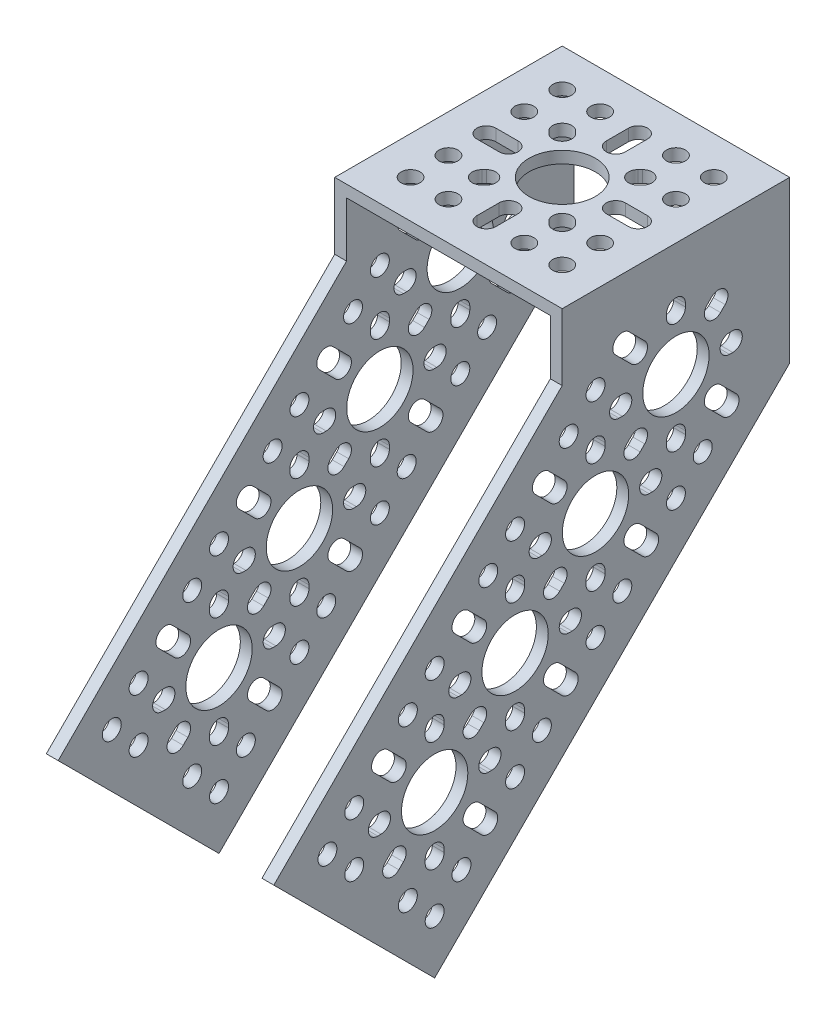
from build123d import *

# Parameters (mm, degrees)
BOSS_EXTRUDE1_DEPTH = 2.5
SKETCH2_W           = 2.5
SKETCH2_H           = 48
BOSS_EXTRUDE2_DEPTH = 11.558874503
SKETCH3_W           = 2.5
SKETCH3_H           = 48
BOSS_EXTRUDE3_DEPTH = 86.058874503
SKETCH4_W           = 45.5
SKETCH4_H           = 48
BOSS_EXTRUDE4_DEPTH = 2.5
BOSS_EXTRUDE5_DEPTH = 2.5
CUT_EXTRUDE1_DEPTH  = 144.461391987
CUT_EXTRUDE2_DEPTH  = 144.461391987
CUT_EXTRUDE3_DEPTH  = 144.461391987
CUT_EXTRUDE4_DEPTH  = 144.461391987
CUT_EXTRUDE5_DEPTH  = 144.461391987
CUT_EXTRUDE6_DEPTH  = 144.461391987
CUT_EXTRUDE7_DEPTH  = 144.461391987
CUT_EXTRUDE8_DEPTH  = 144.461391987
CUT_EXTRUDE9_DEPTH  = 144.461391987
CUT_EXTRUDE10_DEPTH = 144.461391987
CUT_EXTRUDE11_DEPTH = 144.461391987
CUT_EXTRUDE12_DEPTH = 144.461391987
CUT_EXTRUDE13_DEPTH = 144.461391987
CUT_EXTRUDE14_DEPTH = 144.461391987
CUT_EXTRUDE15_DEPTH = 144.461391987
CUT_EXTRUDE16_DEPTH = 144.461391987
CUT_EXTRUDE17_DEPTH = 144.461391987
CUT_EXTRUDE18_DEPTH = 144.461391987
CUT_EXTRUDE19_DEPTH = 144.461391987
CUT_EXTRUDE20_DEPTH = 144.461391987
CUT_EXTRUDE21_DEPTH = 144.461391987
CUT_EXTRUDE22_DEPTH = 144.461391987
CUT_EXTRUDE23_DEPTH = 144.461391987
CUT_EXTRUDE24_DEPTH = 144.461391987
CUT_EXTRUDE25_DEPTH = 144.461391987
CUT_EXTRUDE26_DEPTH = 144.461391987
CUT_EXTRUDE27_DEPTH = 144.461391987
CUT_EXTRUDE28_DEPTH = 144.461391987
CUT_EXTRUDE29_DEPTH = 141.089025479
CUT_EXTRUDE30_DEPTH = 141.089025479
CUT_EXTRUDE31_DEPTH = 141.089025479
CUT_EXTRUDE32_DEPTH = 141.089025479
CUT_EXTRUDE33_DEPTH = 141.089025479
CUT_EXTRUDE34_DEPTH = 141.089025479
CUT_EXTRUDE35_DEPTH = 141.089025479
CUT_EXTRUDE36_REACH = 146.274
CUT_EXTRUDE37_REACH = 146.274
CUT_EXTRUDE38_REACH = 146.274
CUT_EXTRUDE39_REACH = 146.274
CUT_EXTRUDE40_REACH = 146.274
CUT_EXTRUDE41_REACH = 146.274
CUT_EXTRUDE42_REACH = 146.274
CUT_EXTRUDE43_REACH = 146.274
CUT_EXTRUDE44_DEPTH = 145.273770974
CUT_EXTRUDE45_DEPTH = 145.273770974
CUT_EXTRUDE46_DEPTH = 145.273770974
CUT_EXTRUDE47_DEPTH = 145.273770974
CUT_EXTRUDE48_DEPTH = 145.273770974
CUT_EXTRUDE49_DEPTH = 145.273770974
CUT_EXTRUDE50_DEPTH = 145.273770974
CUT_EXTRUDE51_DEPTH = 145.273770974
CUT_EXTRUDE52_DEPTH = 145.273770974
CUT_EXTRUDE53_DEPTH = 145.273770974
CUT_EXTRUDE54_DEPTH = 145.273770974
CUT_EXTRUDE55_DEPTH = 145.273770974
CUT_EXTRUDE56_DEPTH = 145.273770974
CUT_EXTRUDE57_DEPTH = 145.273770974
CUT_EXTRUDE58_DEPTH = 145.273770974
CUT_EXTRUDE59_DEPTH = 145.273770974
CUT_EXTRUDE60_DEPTH = 145.273770974
CUT_EXTRUDE61_DEPTH = 145.273770974
CUT_EXTRUDE62_DEPTH = 145.273770974
CUT_EXTRUDE63_DEPTH = 145.273770974
CUT_EXTRUDE64_REACH = 146.274
CUT_EXTRUDE65_DEPTH = 141.089025479
CUT_EXTRUDE66_DEPTH = 145.273770974
HOLE1_D             = 14
HOLE1_DEPTH         = 2.5
HOLE2_D             = 4
HOLE2_DEPTH         = 2.5
HOLE3_D             = 14
HOLE3_DEPTH         = 108.852813742
HOLE4_D             = 4
HOLE4_DEPTH         = 108.852813742
HOLE5_D             = 14
HOLE5_DEPTH         = 48
HOLE6_D             = 4
HOLE6_DEPTH         = 48


with BuildPart() as part:
    # Sketch1 → Boss-Extrude1 (new body)
    with BuildSketch(Plane(origin=(21.5, 0, 0), x_dir=(0, -1, 0), z_dir=(-1, 0, 0))):
        Polygon((45.5, -9.941125497), (11.558874503, 24), (11.558874503, -24), (31.441125497, -24), align=None)
    extrude(amount=-BOSS_EXTRUDE1_DEPTH)

    # Sketch2 → Boss-Extrude2 (add)
    with BuildSketch(Plane(origin=(0, -11.558874503, 0), x_dir=(-1, 0, 0), z_dir=(0, 1, 0))):
        with Locations((-22.75, 0)):
            Rectangle(SKETCH2_W, SKETCH2_H)
    extrude(amount=BOSS_EXTRUDE2_DEPTH)

    # Sketch3 → Boss-Extrude3 (add)
    with BuildSketch(Plane(origin=(0, -17.779437252, 17.779437252), x_dir=(1, 0, 0), z_dir=(0, -0.7071067811865469, 0.7071067811865481))):
        with Locations((22.75, -15.202795796)):
            Rectangle(SKETCH3_W, SKETCH3_H)
    extrude(amount=BOSS_EXTRUDE3_DEPTH)

    # Sketch4 → Boss-Extrude4 (add)
    with BuildSketch(Plane(origin=(0, 0, 0), x_dir=(-1, 0, 0), z_dir=(0, 1, 0))):
        with Locations((-1.25, 0)):
            Rectangle(SKETCH4_W, SKETCH4_H)
    extrude(amount=BOSS_EXTRUDE4_DEPTH)

    # Sketch5 → Boss-Extrude5 (add)
    with BuildSketch(Plane.ZY.offset(21.5)):
        Polygon((50.911688245, -106.352813742), (-24, -31.441125497), (-24, 2.5), (24, 2.5), (24, -11.558874503), (84.852813742, -72.411688245), align=None)
    extrude(amount=BOSS_EXTRUDE5_DEPTH)

    # Sketch6 → Cut-Extrude1 (cut, through all)
    with BuildSketch(Plane(origin=(-21.5, 0, 0), x_dir=(0, 0, -1), z_dir=(1, 0, 0))):
        with BuildLine():
            Line((-63.639610307, -62.512193309), (-60.325901808, -65.825901808))
            ThreePointArc((-60.325901808, -65.825901808), (-57.497474683, -65.825901808), (-57.497474683, -62.997474683))
            Line((-57.497474683, -62.997474683), (-60.811183182, -59.683766184))
            ThreePointArc((-60.811183182, -59.683766184), (-63.639610307, -59.683766184), (-63.639610307, -62.512193309))
        make_face()
    extrude(amount=-CUT_EXTRUDE1_DEPTH, mode=Mode.SUBTRACT)

    # Sketch7 → Cut-Extrude2 (cut, through all)
    with BuildSketch(Plane(origin=(-21.5, 0, 0), x_dir=(0, 0, -1), z_dir=(1, 0, 0))):
        with BuildLine():
            Line((-44.325901808, -81.825901808), (-41.012193309, -85.139610307))
            ThreePointArc((-41.012193309, -85.139610307), (-38.183766184, -85.139610307), (-38.183766184, -82.311183182))
            Line((-38.183766184, -82.311183182), (-41.497474683, -78.997474683))
            ThreePointArc((-41.497474683, -78.997474683), (-44.325901808, -78.997474683), (-44.325901808, -81.825901808))
        make_face()
    extrude(amount=-CUT_EXTRUDE2_DEPTH, mode=Mode.SUBTRACT)

    # Sketch8 → Cut-Extrude3 (cut, through all)
    with BuildSketch(Plane(origin=(-21.5, 0, 0), x_dir=(0, 0, -1), z_dir=(1, 0, 0))):
        with BuildLine():
            Line((-46.669047558, -45.54163056), (-43.355339059, -48.855339059))
            ThreePointArc((-43.355339059, -48.855339059), (-40.526911935, -48.855339059), (-40.526911935, -46.026911935))
            Line((-40.526911935, -46.026911935), (-43.840620434, -42.713203436))
            ThreePointArc((-43.840620434, -42.713203436), (-46.669047558, -42.713203436), (-46.669047558, -45.54163056))
        make_face()
    extrude(amount=-CUT_EXTRUDE3_DEPTH, mode=Mode.SUBTRACT)

    # Sketch9 → Cut-Extrude4 (cut, through all)
    with BuildSketch(Plane(origin=(-21.5, 0, 0), x_dir=(0, 0, -1), z_dir=(1, 0, 0))):
        with BuildLine():
            Line((-27.355339059, -64.855339059), (-24.04163056, -68.169047558))
            ThreePointArc((-24.04163056, -68.169047558), (-21.213203436, -68.169047558), (-21.213203436, -65.340620434))
            Line((-21.213203436, -65.340620434), (-24.526911935, -62.026911935))
            ThreePointArc((-24.526911935, -62.026911935), (-27.355339059, -62.026911935), (-27.355339059, -64.855339059))
        make_face()
    extrude(amount=-CUT_EXTRUDE4_DEPTH, mode=Mode.SUBTRACT)

    # Sketch10 → Cut-Extrude5 (cut, through all)
    with BuildSketch(Plane(origin=(-21.5, 0, 0), x_dir=(0, 0, -1), z_dir=(1, 0, 0))):
        with BuildLine():
            Line((-29.69848481, -28.571067812), (-26.384776311, -31.884776311))
            ThreePointArc((-26.384776311, -31.884776311), (-23.556349186, -31.884776311), (-23.556349186, -29.056349186))
            Line((-23.556349186, -29.056349186), (-26.870057685, -25.742640687))
            ThreePointArc((-26.870057685, -25.742640687), (-29.69848481, -25.742640687), (-29.69848481, -28.571067812))
        make_face()
    extrude(amount=-CUT_EXTRUDE5_DEPTH, mode=Mode.SUBTRACT)

    # Sketch11 → Cut-Extrude6 (cut, through all)
    with BuildSketch(Plane(origin=(-21.5, 0, 0), x_dir=(0, 0, -1), z_dir=(1, 0, 0))):
        with BuildLine():
            Line((-10.384776311, -47.884776311), (-7.071067812, -51.19848481))
            ThreePointArc((-7.071067812, -51.19848481), (-4.242640687, -51.19848481), (-4.242640687, -48.370057685))
            Line((-4.242640687, -48.370057685), (-7.556349186, -45.056349186))
            ThreePointArc((-7.556349186, -45.056349186), (-10.384776311, -45.056349186), (-10.384776311, -47.884776311))
        make_face()
    extrude(amount=-CUT_EXTRUDE6_DEPTH, mode=Mode.SUBTRACT)

    # Sketch12 → Cut-Extrude7 (cut, through all)
    with BuildSketch(Plane(origin=(-21.5, 0, 0), x_dir=(0, 0, -1), z_dir=(1, 0, 0))):
        with BuildLine():
            Line((-12.727922061, -11.600505063), (-9.414213562, -14.914213562))
            ThreePointArc((-9.414213562, -14.914213562), (-6.585786438, -14.914213562), (-6.585786438, -12.085786438))
            Line((-6.585786438, -12.085786438), (-9.899494937, -8.772077939))
            ThreePointArc((-9.899494937, -8.772077939), (-12.727922061, -8.772077939), (-12.727922061, -11.600505063))
        make_face()
    extrude(amount=-CUT_EXTRUDE7_DEPTH, mode=Mode.SUBTRACT)

    # Sketch13 → Cut-Extrude8 (cut, through all)
    with BuildSketch(Plane(origin=(-21.5, 0, 0), x_dir=(0, 0, -1), z_dir=(1, 0, 0))):
        with BuildLine():
            Line((6.585786438, -30.914213562), (9.899494937, -34.227922061))
            ThreePointArc((9.899494937, -34.227922061), (12.727922061, -34.227922061), (12.727922061, -31.399494937))
            Line((12.727922061, -31.399494937), (9.414213562, -28.085786438))
            ThreePointArc((9.414213562, -28.085786438), (6.585786438, -28.085786438), (6.585786438, -30.914213562))
        make_face()
    extrude(amount=-CUT_EXTRUDE8_DEPTH, mode=Mode.SUBTRACT)

    # Sketch14 → Cut-Extrude9 (cut, through all)
    with BuildSketch(Plane(origin=(-21.5, 0, 0), x_dir=(0, 0, -1), z_dir=(1, 0, 0))):
        with BuildLine():
            Line((-58.468037432, -82.796464556), (-57.497474683, -81.825901808))
            ThreePointArc((-57.497474683, -81.825901808), (-57.497474683, -78.997474683), (-60.325901808, -78.997474683))
            Line((-60.325901808, -78.997474683), (-61.296464556, -79.968037432))
            ThreePointArc((-61.296464556, -79.968037432), (-61.296464556, -82.796464556), (-58.468037432, -82.796464556))
        make_face()
    extrude(amount=-CUT_EXTRUDE9_DEPTH, mode=Mode.SUBTRACT)

    # Sketch15 → Cut-Extrude10 (cut, through all)
    with BuildSketch(Plane(origin=(-21.5, 0, 0), x_dir=(0, 0, -1), z_dir=(1, 0, 0))):
        with BuildLine():
            Line((-41.497474683, -65.825901808), (-40.526911935, -64.855339059))
            ThreePointArc((-40.526911935, -64.855339059), (-40.526911935, -62.026911935), (-43.355339059, -62.026911935))
            Line((-43.355339059, -62.026911935), (-44.325901808, -62.997474683))
            ThreePointArc((-44.325901808, -62.997474683), (-44.325901808, -65.825901808), (-41.497474683, -65.825901808))
        make_face()
    extrude(amount=-CUT_EXTRUDE10_DEPTH, mode=Mode.SUBTRACT)

    # Sketch16 → Cut-Extrude11 (cut, through all)
    with BuildSketch(Plane(origin=(-21.5, 0, 0), x_dir=(0, 0, -1), z_dir=(1, 0, 0))):
        with BuildLine():
            Line((-24.526911935, -48.855339059), (-23.556349186, -47.884776311))
            ThreePointArc((-23.556349186, -47.884776311), (-23.556349186, -45.056349186), (-26.384776311, -45.056349186))
            Line((-26.384776311, -45.056349186), (-27.355339059, -46.026911935))
            ThreePointArc((-27.355339059, -46.026911935), (-27.355339059, -48.855339059), (-24.526911935, -48.855339059))
        make_face()
    extrude(amount=-CUT_EXTRUDE11_DEPTH, mode=Mode.SUBTRACT)

    # Sketch17 → Cut-Extrude12 (cut, through all)
    with BuildSketch(Plane(origin=(-21.5, 0, 0), x_dir=(0, 0, -1), z_dir=(1, 0, 0))):
        with BuildLine():
            Line((-7.556349186, -31.884776311), (-6.585786438, -30.914213562))
            ThreePointArc((-6.585786438, -30.914213562), (-6.585786438, -28.085786438), (-9.414213562, -28.085786438))
            Line((-9.414213562, -28.085786438), (-10.384776311, -29.056349186))
            ThreePointArc((-10.384776311, -29.056349186), (-10.384776311, -31.884776311), (-7.556349186, -31.884776311))
        make_face()
    extrude(amount=-CUT_EXTRUDE12_DEPTH, mode=Mode.SUBTRACT)

    # Sketch18 → Cut-Extrude13 (cut, through all)
    with BuildSketch(Plane(origin=(-21.5, 0, 0), x_dir=(0, 0, -1), z_dir=(1, 0, 0))):
        with BuildLine():
            Line((7.556349186, -11.115223689), (6.585786438, -12.085786438))
            ThreePointArc((6.585786438, -12.085786438), (6.585786438, -14.914213562), (9.414213562, -14.914213562))
            Line((9.414213562, -14.914213562), (10.384776311, -13.943650814))
            ThreePointArc((10.384776311, -13.943650814), (10.384776311, -11.115223689), (7.556349186, -11.115223689))
        make_face()
    extrude(amount=-CUT_EXTRUDE13_DEPTH, mode=Mode.SUBTRACT)

    # Sketch19 → Cut-Extrude14 (cut, through all)
    with BuildSketch(Plane(origin=(-21.5, 0, 0), x_dir=(0, 0, -1), z_dir=(1, 0, 0))):
        with BuildLine():
            Line((-48.911688245, -61.097979746), (-48.911688245, -60.411688245))
            ThreePointArc((-48.911688245, -60.411688245), (-50.911688245, -58.411688245), (-52.911688245, -60.411688245))
            Line((-52.911688245, -60.411688245), (-52.911688245, -61.097979746))
            ThreePointArc((-52.911688245, -61.097979746), (-50.911688245, -63.097979746), (-48.911688245, -61.097979746))
        make_face()
    extrude(amount=-CUT_EXTRUDE14_DEPTH, mode=Mode.SUBTRACT)

    # Sketch20 → Cut-Extrude15 (cut, through all)
    with BuildSketch(Plane(origin=(-21.5, 0, 0), x_dir=(0, 0, -1), z_dir=(1, 0, 0))):
        with BuildLine():
            Line((-39.597979746, -74.411688245), (-38.911688245, -74.411688245))
            ThreePointArc((-38.911688245, -74.411688245), (-36.911688245, -72.411688245), (-38.911688245, -70.411688245))
            Line((-38.911688245, -70.411688245), (-39.597979746, -70.411688245))
            ThreePointArc((-39.597979746, -70.411688245), (-41.597979746, -72.411688245), (-39.597979746, -74.411688245))
        make_face()
    extrude(amount=-CUT_EXTRUDE15_DEPTH, mode=Mode.SUBTRACT)

    # Sketch21 → Cut-Extrude16 (cut, through all)
    with BuildSketch(Plane(origin=(-21.5, 0, 0), x_dir=(0, 0, -1), z_dir=(1, 0, 0))):
        with BuildLine():
            Line((-52.911688245, -83.725396744), (-52.911688245, -84.411688245))
            ThreePointArc((-52.911688245, -84.411688245), (-50.911688245, -86.411688245), (-48.911688245, -84.411688245))
            Line((-48.911688245, -84.411688245), (-48.911688245, -83.725396744))
            ThreePointArc((-48.911688245, -83.725396744), (-50.911688245, -81.725396744), (-52.911688245, -83.725396744))
        make_face()
    extrude(amount=-CUT_EXTRUDE16_DEPTH, mode=Mode.SUBTRACT)

    # Sketch22 → Cut-Extrude17 (cut, through all)
    with BuildSketch(Plane(origin=(-21.5, 0, 0), x_dir=(0, 0, -1), z_dir=(1, 0, 0))):
        with BuildLine():
            Line((-62.911688245, -74.411688245), (-62.225396744, -74.411688245))
            ThreePointArc((-62.225396744, -74.411688245), (-60.225396744, -72.411688245), (-62.225396744, -70.411688245))
            Line((-62.225396744, -70.411688245), (-62.911688245, -70.411688245))
            ThreePointArc((-62.911688245, -70.411688245), (-64.911688245, -72.411688245), (-62.911688245, -74.411688245))
        make_face()
    extrude(amount=-CUT_EXTRUDE17_DEPTH, mode=Mode.SUBTRACT)

    # Sketch23 → Cut-Extrude18 (cut, through all)
    with BuildSketch(Plane(origin=(-21.5, 0, 0), x_dir=(0, 0, -1), z_dir=(1, 0, 0))):
        with BuildLine():
            Line((-31.941125497, -44.127416998), (-31.941125497, -43.441125497))
            ThreePointArc((-31.941125497, -43.441125497), (-33.941125497, -41.441125497), (-35.941125497, -43.441125497))
            Line((-35.941125497, -43.441125497), (-35.941125497, -44.127416998))
            ThreePointArc((-35.941125497, -44.127416998), (-33.941125497, -46.127416998), (-31.941125497, -44.127416998))
        make_face()
    extrude(amount=-CUT_EXTRUDE18_DEPTH, mode=Mode.SUBTRACT)

    # Sketch24 → Cut-Extrude19 (cut, through all)
    with BuildSketch(Plane(origin=(-21.5, 0, 0), x_dir=(0, 0, -1), z_dir=(1, 0, 0))):
        with BuildLine():
            Line((-22.627416998, -57.441125497), (-21.941125497, -57.441125497))
            ThreePointArc((-21.941125497, -57.441125497), (-19.941125497, -55.441125497), (-21.941125497, -53.441125497))
            Line((-21.941125497, -53.441125497), (-22.627416998, -53.441125497))
            ThreePointArc((-22.627416998, -53.441125497), (-24.627416998, -55.441125497), (-22.627416998, -57.441125497))
        make_face()
    extrude(amount=-CUT_EXTRUDE19_DEPTH, mode=Mode.SUBTRACT)

    # Sketch25 → Cut-Extrude20 (cut, through all)
    with BuildSketch(Plane(origin=(-21.5, 0, 0), x_dir=(0, 0, -1), z_dir=(1, 0, 0))):
        with BuildLine():
            Line((-35.941125497, -66.754833996), (-35.941125497, -67.441125497))
            ThreePointArc((-35.941125497, -67.441125497), (-33.941125497, -69.441125497), (-31.941125497, -67.441125497))
            Line((-31.941125497, -67.441125497), (-31.941125497, -66.754833996))
            ThreePointArc((-31.941125497, -66.754833996), (-33.941125497, -64.754833996), (-35.941125497, -66.754833996))
        make_face()
    extrude(amount=-CUT_EXTRUDE20_DEPTH, mode=Mode.SUBTRACT)

    # Sketch26 → Cut-Extrude21 (cut, through all)
    with BuildSketch(Plane(origin=(-21.5, 0, 0), x_dir=(0, 0, -1), z_dir=(1, 0, 0))):
        with BuildLine():
            Line((-45.941125497, -57.441125497), (-45.254833996, -57.441125497))
            ThreePointArc((-45.254833996, -57.441125497), (-43.254833996, -55.441125497), (-45.254833996, -53.441125497))
            Line((-45.254833996, -53.441125497), (-45.941125497, -53.441125497))
            ThreePointArc((-45.941125497, -53.441125497), (-47.941125497, -55.441125497), (-45.941125497, -57.441125497))
        make_face()
    extrude(amount=-CUT_EXTRUDE21_DEPTH, mode=Mode.SUBTRACT)

    # Sketch27 → Cut-Extrude22 (cut, through all)
    with BuildSketch(Plane(origin=(-21.5, 0, 0), x_dir=(0, 0, -1), z_dir=(1, 0, 0))):
        with BuildLine():
            Line((-14.970562748, -27.156854249), (-14.970562748, -26.470562748))
            ThreePointArc((-14.970562748, -26.470562748), (-16.970562748, -24.470562748), (-18.970562748, -26.470562748))
            Line((-18.970562748, -26.470562748), (-18.970562748, -27.156854249))
            ThreePointArc((-18.970562748, -27.156854249), (-16.970562748, -29.156854249), (-14.970562748, -27.156854249))
        make_face()
    extrude(amount=-CUT_EXTRUDE22_DEPTH, mode=Mode.SUBTRACT)

    # Sketch28 → Cut-Extrude23 (cut, through all)
    with BuildSketch(Plane(origin=(-21.5, 0, 0), x_dir=(0, 0, -1), z_dir=(1, 0, 0))):
        with BuildLine():
            Line((-5.656854249, -40.470562748), (-4.970562748, -40.470562748))
            ThreePointArc((-4.970562748, -40.470562748), (-2.970562748, -38.470562748), (-4.970562748, -36.470562748))
            Line((-4.970562748, -36.470562748), (-5.656854249, -36.470562748))
            ThreePointArc((-5.656854249, -36.470562748), (-7.656854249, -38.470562748), (-5.656854249, -40.470562748))
        make_face()
    extrude(amount=-CUT_EXTRUDE23_DEPTH, mode=Mode.SUBTRACT)

    # Sketch29 → Cut-Extrude24 (cut, through all)
    with BuildSketch(Plane(origin=(-21.5, 0, 0), x_dir=(0, 0, -1), z_dir=(1, 0, 0))):
        with BuildLine():
            Line((-18.970562748, -49.784271247), (-18.970562748, -50.470562748))
            ThreePointArc((-18.970562748, -50.470562748), (-16.970562748, -52.470562748), (-14.970562748, -50.470562748))
            Line((-14.970562748, -50.470562748), (-14.970562748, -49.784271247))
            ThreePointArc((-14.970562748, -49.784271247), (-16.970562748, -47.784271247), (-18.970562748, -49.784271247))
        make_face()
    extrude(amount=-CUT_EXTRUDE24_DEPTH, mode=Mode.SUBTRACT)

    # Sketch30 → Cut-Extrude25 (cut, through all)
    with BuildSketch(Plane(origin=(-21.5, 0, 0), x_dir=(0, 0, -1), z_dir=(1, 0, 0))):
        with BuildLine():
            Line((-28.970562748, -40.470562748), (-28.284271247, -40.470562748))
            ThreePointArc((-28.284271247, -40.470562748), (-26.284271247, -38.470562748), (-28.284271247, -36.470562748))
            Line((-28.284271247, -36.470562748), (-28.970562748, -36.470562748))
            ThreePointArc((-28.970562748, -36.470562748), (-30.970562748, -38.470562748), (-28.970562748, -40.470562748))
        make_face()
    extrude(amount=-CUT_EXTRUDE25_DEPTH, mode=Mode.SUBTRACT)

    # Sketch31 → Cut-Extrude26 (cut, through all)
    with BuildSketch(Plane(origin=(-21.5, 0, 0), x_dir=(0, 0, -1), z_dir=(1, 0, 0))):
        with BuildLine():
            Line((2, -10.186291501), (2, -9.5))
            ThreePointArc((2, -9.5), (0, -7.5), (-2, -9.5))
            Line((-2, -9.5), (-2, -10.186291501))
            ThreePointArc((-2, -10.186291501), (0, -12.186291501), (2, -10.186291501))
        make_face()
    extrude(amount=-CUT_EXTRUDE26_DEPTH, mode=Mode.SUBTRACT)

    # Sketch32 → Cut-Extrude27 (cut, through all)
    with BuildSketch(Plane(origin=(-21.5, 0, 0), x_dir=(0, 0, -1), z_dir=(1, 0, 0))):
        with BuildLine():
            Line((11.313708499, -23.5), (12, -23.5))
            ThreePointArc((12, -23.5), (14, -21.5), (12, -19.5))
            Line((12, -19.5), (11.313708499, -19.5))
            ThreePointArc((11.313708499, -19.5), (9.313708499, -21.5), (11.313708499, -23.5))
        make_face()
    extrude(amount=-CUT_EXTRUDE27_DEPTH, mode=Mode.SUBTRACT)

    # Sketch33 → Cut-Extrude28 (cut, through all)
    with BuildSketch(Plane(origin=(-21.5, 0, 0), x_dir=(0, 0, -1), z_dir=(1, 0, 0))):
        with BuildLine():
            Line((-2, -32.813708499), (-2, -33.5))
            ThreePointArc((-2, -33.5), (0, -35.5), (2, -33.5))
            Line((2, -33.5), (2, -32.813708499))
            ThreePointArc((2, -32.813708499), (0, -30.813708499), (-2, -32.813708499))
        make_face()
    extrude(amount=-CUT_EXTRUDE28_DEPTH, mode=Mode.SUBTRACT)

    # Sketch34 → Cut-Extrude29 (cut, through all)
    with BuildSketch(Plane(origin=(0, 2.5, 0), x_dir=(-1, 0, 0), z_dir=(0, 1, 0))):
        with BuildLine():
            Line((-2, -11.313708499), (-2, -16))
            ThreePointArc((-2, -16), (0, -18), (2, -16))
            Line((2, -16), (2, -11.313708499))
            ThreePointArc((2, -11.313708499), (0, -9.313708499), (-2, -11.313708499))
        make_face()
    extrude(amount=-CUT_EXTRUDE29_DEPTH, mode=Mode.SUBTRACT)

    # Sketch35 → Cut-Extrude30 (cut, through all)
    with BuildSketch(Plane(origin=(0, 2.5, 0), x_dir=(-1, 0, 0), z_dir=(0, 1, 0))):
        with BuildLine():
            Line((11.313708499, -2), (16, -2))
            ThreePointArc((16, -2), (18, 0), (16, 2))
            Line((16, 2), (11.313708499, 2))
            ThreePointArc((11.313708499, 2), (9.313708499, 0), (11.313708499, -2))
        make_face()
    extrude(amount=-CUT_EXTRUDE30_DEPTH, mode=Mode.SUBTRACT)

    # Sketch36 → Cut-Extrude31 (cut, through all)
    with BuildSketch(Plane(origin=(0, 2.5, 0), x_dir=(-1, 0, 0), z_dir=(0, 1, 0))):
        with BuildLine():
            Line((2, 11.313708499), (2, 16))
            ThreePointArc((2, 16), (0, 18), (-2, 16))
            Line((-2, 16), (-2, 11.313708499))
            ThreePointArc((-2, 11.313708499), (0, 9.313708499), (2, 11.313708499))
        make_face()
    extrude(amount=-CUT_EXTRUDE31_DEPTH, mode=Mode.SUBTRACT)

    # Sketch37 → Cut-Extrude32 (cut, through all)
    with BuildSketch(Plane(origin=(0, 2.5, 0), x_dir=(-1, 0, 0), z_dir=(0, 1, 0))):
        with BuildLine():
            Line((-11.313708499, 2), (-16, 2))
            ThreePointArc((-16, 2), (-18, 0), (-16, -2))
            Line((-16, -2), (-11.313708499, -2))
            ThreePointArc((-11.313708499, -2), (-9.313708499, 0), (-11.313708499, 2))
        make_face()
    extrude(amount=-CUT_EXTRUDE32_DEPTH, mode=Mode.SUBTRACT)

    # Sketch38 → Cut-Extrude33 (cut, through all)
    with BuildSketch(Plane(origin=(0, 2.5, 0), x_dir=(-1, 0, 0), z_dir=(0, 1, 0))):
        with BuildLine():
            Line((-7.071067812, -9.899494937), (-6.585786438, -9.414213562))
            ThreePointArc((-6.585786438, -9.414213562), (-6.585786438, -6.585786438), (-9.414213562, -6.585786438))
            Line((-9.414213562, -6.585786438), (-9.899494937, -7.071067812))
            ThreePointArc((-9.899494937, -7.071067812), (-9.899494937, -9.899494937), (-7.071067812, -9.899494937))
        make_face()
    extrude(amount=-CUT_EXTRUDE33_DEPTH, mode=Mode.SUBTRACT)

    # Sketch39 → Cut-Extrude34 (cut, through all)
    with BuildSketch(Plane(origin=(0, 2.5, 0), x_dir=(-1, 0, 0), z_dir=(0, 1, 0))):
        with BuildLine():
            Line((6.585786438, -9.414213562), (7.071067812, -9.899494937))
            ThreePointArc((7.071067812, -9.899494937), (9.899494937, -9.899494937), (9.899494937, -7.071067812))
            Line((9.899494937, -7.071067812), (9.414213562, -6.585786438))
            ThreePointArc((9.414213562, -6.585786438), (6.585786438, -6.585786438), (6.585786438, -9.414213562))
        make_face()
    extrude(amount=-CUT_EXTRUDE34_DEPTH, mode=Mode.SUBTRACT)

    # Sketch40 → Cut-Extrude35 (cut, through all)
    with BuildSketch(Plane(origin=(0, 2.5, 0), x_dir=(-1, 0, 0), z_dir=(0, 1, 0))):
        with BuildLine():
            Line((9.414213562, 6.585786438), (9.899494937, 7.071067812))
            ThreePointArc((9.899494937, 7.071067812), (9.899494937, 9.899494937), (7.071067812, 9.899494937))
            Line((7.071067812, 9.899494937), (6.585786438, 9.414213562))
            ThreePointArc((6.585786438, 9.414213562), (6.585786438, 6.585786438), (9.414213562, 6.585786438))
        make_face()
    extrude(amount=-CUT_EXTRUDE35_DEPTH, mode=Mode.SUBTRACT)

    # Sketch41 → Cut-Extrude36 (cut, up to next)
    with BuildSketch(Plane(origin=(24, 0, 0), x_dir=(0, 0, -1), z_dir=(1, 0, 0)), mode=Mode.PRIVATE) as cut_extrude36_sk1:
        with BuildLine():
            Line((-63.639610307, -62.512193309), (-60.325901808, -65.825901808))
            ThreePointArc((-60.325901808, -65.825901808), (-57.497474683, -65.825901808), (-57.497474683, -62.997474683))
            Line((-57.497474683, -62.997474683), (-60.811183182, -59.683766184))
            ThreePointArc((-60.811183182, -59.683766184), (-63.639610307, -59.683766184), (-63.639610307, -62.512193309))
        make_face()
    cut_extrude36_tool1 = extrude(cut_extrude36_sk1.sketch, amount=-CUT_EXTRUDE36_REACH, mode=Mode.PRIVATE) & part.part
    add(cut_extrude36_tool1.solids().sort_by_distance((24, -62.754834, 60.568542))[0], mode=Mode.SUBTRACT)

    # Sketch42 → Cut-Extrude37 (cut, up to next)
    with BuildSketch(Plane(origin=(24, 0, 0), x_dir=(0, 0, -1), z_dir=(1, 0, 0)), mode=Mode.PRIVATE) as cut_extrude37_sk1:
        with BuildLine():
            Line((-44.325901808, -81.825901808), (-41.012193309, -85.139610307))
            ThreePointArc((-41.012193309, -85.139610307), (-38.183766184, -85.139610307), (-38.183766184, -82.311183182))
            Line((-38.183766184, -82.311183182), (-41.497474683, -78.997474683))
            ThreePointArc((-41.497474683, -78.997474683), (-44.325901808, -78.997474683), (-44.325901808, -81.825901808))
        make_face()
    cut_extrude37_tool1 = extrude(cut_extrude37_sk1.sketch, amount=-CUT_EXTRUDE37_REACH, mode=Mode.PRIVATE) & part.part
    add(cut_extrude37_tool1.solids().sort_by_distance((24, -82.068542, 41.254834))[0], mode=Mode.SUBTRACT)

    # Sketch43 → Cut-Extrude38 (cut, up to next)
    with BuildSketch(Plane(origin=(24, 0, 0), x_dir=(0, 0, -1), z_dir=(1, 0, 0)), mode=Mode.PRIVATE) as cut_extrude38_sk1:
        with BuildLine():
            Line((-46.669047558, -45.54163056), (-43.355339059, -48.855339059))
            ThreePointArc((-43.355339059, -48.855339059), (-40.526911935, -48.855339059), (-40.526911935, -46.026911935))
            Line((-40.526911935, -46.026911935), (-43.840620434, -42.713203436))
            ThreePointArc((-43.840620434, -42.713203436), (-46.669047558, -42.713203436), (-46.669047558, -45.54163056))
        make_face()
    cut_extrude38_tool1 = extrude(cut_extrude38_sk1.sketch, amount=-CUT_EXTRUDE38_REACH, mode=Mode.PRIVATE) & part.part
    add(cut_extrude38_tool1.solids().sort_by_distance((24, -45.784271, 43.59798))[0], mode=Mode.SUBTRACT)

    # Sketch44 → Cut-Extrude39 (cut, up to next)
    with BuildSketch(Plane(origin=(24, 0, 0), x_dir=(0, 0, -1), z_dir=(1, 0, 0)), mode=Mode.PRIVATE) as cut_extrude39_sk1:
        with BuildLine():
            Line((-27.355339059, -64.855339059), (-24.04163056, -68.169047558))
            ThreePointArc((-24.04163056, -68.169047558), (-21.213203436, -68.169047558), (-21.213203436, -65.340620434))
            Line((-21.213203436, -65.340620434), (-24.526911935, -62.026911935))
            ThreePointArc((-24.526911935, -62.026911935), (-27.355339059, -62.026911935), (-27.355339059, -64.855339059))
        make_face()
    cut_extrude39_tool1 = extrude(cut_extrude39_sk1.sketch, amount=-CUT_EXTRUDE39_REACH, mode=Mode.PRIVATE) & part.part
    add(cut_extrude39_tool1.solids().sort_by_distance((24, -65.09798, 24.284271))[0], mode=Mode.SUBTRACT)

    # Sketch45 → Cut-Extrude40 (cut, up to next)
    with BuildSketch(Plane(origin=(24, 0, 0), x_dir=(0, 0, -1), z_dir=(1, 0, 0)), mode=Mode.PRIVATE) as cut_extrude40_sk1:
        with BuildLine():
            Line((-29.69848481, -28.571067812), (-26.384776311, -31.884776311))
            ThreePointArc((-26.384776311, -31.884776311), (-23.556349186, -31.884776311), (-23.556349186, -29.056349186))
            Line((-23.556349186, -29.056349186), (-26.870057685, -25.742640687))
            ThreePointArc((-26.870057685, -25.742640687), (-29.69848481, -25.742640687), (-29.69848481, -28.571067812))
        make_face()
    cut_extrude40_tool1 = extrude(cut_extrude40_sk1.sketch, amount=-CUT_EXTRUDE40_REACH, mode=Mode.PRIVATE) & part.part
    add(cut_extrude40_tool1.solids().sort_by_distance((24, -28.813708, 26.627417))[0], mode=Mode.SUBTRACT)

    # Sketch46 → Cut-Extrude41 (cut, up to next)
    with BuildSketch(Plane(origin=(24, 0, 0), x_dir=(0, 0, -1), z_dir=(1, 0, 0)), mode=Mode.PRIVATE) as cut_extrude41_sk1:
        with BuildLine():
            Line((-10.384776311, -47.884776311), (-7.071067812, -51.19848481))
            ThreePointArc((-7.071067812, -51.19848481), (-4.242640687, -51.19848481), (-4.242640687, -48.370057685))
            Line((-4.242640687, -48.370057685), (-7.556349186, -45.056349186))
            ThreePointArc((-7.556349186, -45.056349186), (-10.384776311, -45.056349186), (-10.384776311, -47.884776311))
        make_face()
    cut_extrude41_tool1 = extrude(cut_extrude41_sk1.sketch, amount=-CUT_EXTRUDE41_REACH, mode=Mode.PRIVATE) & part.part
    add(cut_extrude41_tool1.solids().sort_by_distance((24, -48.127417, 7.313708))[0], mode=Mode.SUBTRACT)

    # Sketch47 → Cut-Extrude42 (cut, up to next)
    with BuildSketch(Plane(origin=(24, 0, 0), x_dir=(0, 0, -1), z_dir=(1, 0, 0)), mode=Mode.PRIVATE) as cut_extrude42_sk1:
        with BuildLine():
            Line((-12.727922061, -11.600505063), (-9.414213562, -14.914213562))
            ThreePointArc((-9.414213562, -14.914213562), (-6.585786438, -14.914213562), (-6.585786438, -12.085786438))
            Line((-6.585786438, -12.085786438), (-9.899494937, -8.772077939))
            ThreePointArc((-9.899494937, -8.772077939), (-12.727922061, -8.772077939), (-12.727922061, -11.600505063))
        make_face()
    cut_extrude42_tool1 = extrude(cut_extrude42_sk1.sketch, amount=-CUT_EXTRUDE42_REACH, mode=Mode.PRIVATE) & part.part
    add(cut_extrude42_tool1.solids().sort_by_distance((24, -11.843146, 9.656854))[0], mode=Mode.SUBTRACT)

    # Sketch48 → Cut-Extrude43 (cut, up to next)
    with BuildSketch(Plane(origin=(24, 0, 0), x_dir=(0, 0, -1), z_dir=(1, 0, 0)), mode=Mode.PRIVATE) as cut_extrude43_sk1:
        with BuildLine():
            Line((6.585786438, -30.914213562), (9.899494937, -34.227922061))
            ThreePointArc((9.899494937, -34.227922061), (12.727922061, -34.227922061), (12.727922061, -31.399494937))
            Line((12.727922061, -31.399494937), (9.414213562, -28.085786438))
            ThreePointArc((9.414213562, -28.085786438), (6.585786438, -28.085786438), (6.585786438, -30.914213562))
        make_face()
    cut_extrude43_tool1 = extrude(cut_extrude43_sk1.sketch, amount=-CUT_EXTRUDE43_REACH, mode=Mode.PRIVATE) & part.part
    add(cut_extrude43_tool1.solids().sort_by_distance((24, -31.156854, -9.656854))[0], mode=Mode.SUBTRACT)

    # Sketch49 → Cut-Extrude44 (cut, through all)
    with BuildSketch(Plane(origin=(24, 0, 0), x_dir=(0, 0, -1), z_dir=(1, 0, 0))):
        with BuildLine():
            Line((-58.468037432, -82.796464556), (-57.497474683, -81.825901808))
            ThreePointArc((-57.497474683, -81.825901808), (-57.497474683, -78.997474683), (-60.325901808, -78.997474683))
            Line((-60.325901808, -78.997474683), (-61.296464556, -79.968037432))
            ThreePointArc((-61.296464556, -79.968037432), (-61.296464556, -82.796464556), (-58.468037432, -82.796464556))
        make_face()
    extrude(amount=-CUT_EXTRUDE44_DEPTH, mode=Mode.SUBTRACT)

    # Sketch50 → Cut-Extrude45 (cut, through all)
    with BuildSketch(Plane(origin=(24, 0, 0), x_dir=(0, 0, -1), z_dir=(1, 0, 0))):
        with BuildLine():
            Line((-41.497474683, -65.825901808), (-40.526911935, -64.855339059))
            ThreePointArc((-40.526911935, -64.855339059), (-40.526911935, -62.026911935), (-43.355339059, -62.026911935))
            Line((-43.355339059, -62.026911935), (-44.325901808, -62.997474683))
            ThreePointArc((-44.325901808, -62.997474683), (-44.325901808, -65.825901808), (-41.497474683, -65.825901808))
        make_face()
    extrude(amount=-CUT_EXTRUDE45_DEPTH, mode=Mode.SUBTRACT)

    # Sketch51 → Cut-Extrude46 (cut, through all)
    with BuildSketch(Plane(origin=(24, 0, 0), x_dir=(0, 0, -1), z_dir=(1, 0, 0))):
        with BuildLine():
            Line((-24.526911935, -48.855339059), (-23.556349186, -47.884776311))
            ThreePointArc((-23.556349186, -47.884776311), (-23.556349186, -45.056349186), (-26.384776311, -45.056349186))
            Line((-26.384776311, -45.056349186), (-27.355339059, -46.026911935))
            ThreePointArc((-27.355339059, -46.026911935), (-27.355339059, -48.855339059), (-24.526911935, -48.855339059))
        make_face()
    extrude(amount=-CUT_EXTRUDE46_DEPTH, mode=Mode.SUBTRACT)

    # Sketch52 → Cut-Extrude47 (cut, through all)
    with BuildSketch(Plane(origin=(24, 0, 0), x_dir=(0, 0, -1), z_dir=(1, 0, 0))):
        with BuildLine():
            Line((-7.556349186, -31.884776311), (-6.585786438, -30.914213562))
            ThreePointArc((-6.585786438, -30.914213562), (-6.585786438, -28.085786438), (-9.414213562, -28.085786438))
            Line((-9.414213562, -28.085786438), (-10.384776311, -29.056349186))
            ThreePointArc((-10.384776311, -29.056349186), (-10.384776311, -31.884776311), (-7.556349186, -31.884776311))
        make_face()
    extrude(amount=-CUT_EXTRUDE47_DEPTH, mode=Mode.SUBTRACT)

    # Sketch53 → Cut-Extrude48 (cut, through all)
    with BuildSketch(Plane(origin=(24, 0, 0), x_dir=(0, 0, -1), z_dir=(1, 0, 0))):
        with BuildLine():
            Line((7.556349186, -11.115223689), (6.585786438, -12.085786438))
            ThreePointArc((6.585786438, -12.085786438), (6.585786438, -14.914213562), (9.414213562, -14.914213562))
            Line((9.414213562, -14.914213562), (10.384776311, -13.943650814))
            ThreePointArc((10.384776311, -13.943650814), (10.384776311, -11.115223689), (7.556349186, -11.115223689))
        make_face()
    extrude(amount=-CUT_EXTRUDE48_DEPTH, mode=Mode.SUBTRACT)

    # Sketch54 → Cut-Extrude49 (cut, through all)
    with BuildSketch(Plane(origin=(24, 0, 0), x_dir=(0, 0, -1), z_dir=(1, 0, 0))):
        with BuildLine():
            Line((-48.911688245, -61.097979746), (-48.911688245, -60.411688245))
            ThreePointArc((-48.911688245, -60.411688245), (-50.911688245, -58.411688245), (-52.911688245, -60.411688245))
            Line((-52.911688245, -60.411688245), (-52.911688245, -61.097979746))
            ThreePointArc((-52.911688245, -61.097979746), (-50.911688245, -63.097979746), (-48.911688245, -61.097979746))
        make_face()
    extrude(amount=-CUT_EXTRUDE49_DEPTH, mode=Mode.SUBTRACT)

    # Sketch55 → Cut-Extrude50 (cut, through all)
    with BuildSketch(Plane(origin=(24, 0, 0), x_dir=(0, 0, -1), z_dir=(1, 0, 0))):
        with BuildLine():
            Line((-39.597979746, -74.411688245), (-38.911688245, -74.411688245))
            ThreePointArc((-38.911688245, -74.411688245), (-36.911688245, -72.411688245), (-38.911688245, -70.411688245))
            Line((-38.911688245, -70.411688245), (-39.597979746, -70.411688245))
            ThreePointArc((-39.597979746, -70.411688245), (-41.597979746, -72.411688245), (-39.597979746, -74.411688245))
        make_face()
    extrude(amount=-CUT_EXTRUDE50_DEPTH, mode=Mode.SUBTRACT)

    # Sketch56 → Cut-Extrude51 (cut, through all)
    with BuildSketch(Plane(origin=(24, 0, 0), x_dir=(0, 0, -1), z_dir=(1, 0, 0))):
        with BuildLine():
            Line((-52.911688245, -83.725396744), (-52.911688245, -84.411688245))
            ThreePointArc((-52.911688245, -84.411688245), (-50.911688245, -86.411688245), (-48.911688245, -84.411688245))
            Line((-48.911688245, -84.411688245), (-48.911688245, -83.725396744))
            ThreePointArc((-48.911688245, -83.725396744), (-50.911688245, -81.725396744), (-52.911688245, -83.725396744))
        make_face()
    extrude(amount=-CUT_EXTRUDE51_DEPTH, mode=Mode.SUBTRACT)

    # Sketch57 → Cut-Extrude52 (cut, through all)
    with BuildSketch(Plane(origin=(24, 0, 0), x_dir=(0, 0, -1), z_dir=(1, 0, 0))):
        with BuildLine():
            Line((-62.225396744, -70.411688245), (-62.911688245, -70.411688245))
            ThreePointArc((-62.911688245, -70.411688245), (-64.911688245, -72.411688245), (-62.911688245, -74.411688245))
            Line((-62.911688245, -74.411688245), (-62.225396744, -74.411688245))
            ThreePointArc((-62.225396744, -74.411688245), (-60.225396744, -72.411688245), (-62.225396744, -70.411688245))
        make_face()
    extrude(amount=-CUT_EXTRUDE52_DEPTH, mode=Mode.SUBTRACT)

    # Sketch58 → Cut-Extrude53 (cut, through all)
    with BuildSketch(Plane(origin=(24, 0, 0), x_dir=(0, 0, -1), z_dir=(1, 0, 0))):
        with BuildLine():
            Line((-31.941125497, -44.127416998), (-31.941125497, -43.441125497))
            ThreePointArc((-31.941125497, -43.441125497), (-33.941125497, -41.441125497), (-35.941125497, -43.441125497))
            Line((-35.941125497, -43.441125497), (-35.941125497, -44.127416998))
            ThreePointArc((-35.941125497, -44.127416998), (-33.941125497, -46.127416998), (-31.941125497, -44.127416998))
        make_face()
    extrude(amount=-CUT_EXTRUDE53_DEPTH, mode=Mode.SUBTRACT)

    # Sketch59 → Cut-Extrude54 (cut, through all)
    with BuildSketch(Plane(origin=(24, 0, 0), x_dir=(0, 0, -1), z_dir=(1, 0, 0))):
        with BuildLine():
            Line((-22.627416998, -57.441125497), (-21.941125497, -57.441125497))
            ThreePointArc((-21.941125497, -57.441125497), (-19.941125497, -55.441125497), (-21.941125497, -53.441125497))
            Line((-21.941125497, -53.441125497), (-22.627416998, -53.441125497))
            ThreePointArc((-22.627416998, -53.441125497), (-24.627416998, -55.441125497), (-22.627416998, -57.441125497))
        make_face()
    extrude(amount=-CUT_EXTRUDE54_DEPTH, mode=Mode.SUBTRACT)

    # Sketch60 → Cut-Extrude55 (cut, through all)
    with BuildSketch(Plane(origin=(24, 0, 0), x_dir=(0, 0, -1), z_dir=(1, 0, 0))):
        with BuildLine():
            Line((-35.941125497, -66.754833996), (-35.941125497, -67.441125497))
            ThreePointArc((-35.941125497, -67.441125497), (-33.941125497, -69.441125497), (-31.941125497, -67.441125497))
            Line((-31.941125497, -67.441125497), (-31.941125497, -66.754833996))
            ThreePointArc((-31.941125497, -66.754833996), (-33.941125497, -64.754833996), (-35.941125497, -66.754833996))
        make_face()
    extrude(amount=-CUT_EXTRUDE55_DEPTH, mode=Mode.SUBTRACT)

    # Sketch61 → Cut-Extrude56 (cut, through all)
    with BuildSketch(Plane(origin=(24, 0, 0), x_dir=(0, 0, -1), z_dir=(1, 0, 0))):
        with BuildLine():
            Line((-45.254833996, -53.441125497), (-45.941125497, -53.441125497))
            ThreePointArc((-45.941125497, -53.441125497), (-47.941125497, -55.441125497), (-45.941125497, -57.441125497))
            Line((-45.941125497, -57.441125497), (-45.254833996, -57.441125497))
            ThreePointArc((-45.254833996, -57.441125497), (-43.254833996, -55.441125497), (-45.254833996, -53.441125497))
        make_face()
    extrude(amount=-CUT_EXTRUDE56_DEPTH, mode=Mode.SUBTRACT)

    # Sketch62 → Cut-Extrude57 (cut, through all)
    with BuildSketch(Plane(origin=(24, 0, 0), x_dir=(0, 0, -1), z_dir=(1, 0, 0))):
        with BuildLine():
            Line((-14.970562748, -27.156854249), (-14.970562748, -26.470562748))
            ThreePointArc((-14.970562748, -26.470562748), (-16.970562748, -24.470562748), (-18.970562748, -26.470562748))
            Line((-18.970562748, -26.470562748), (-18.970562748, -27.156854249))
            ThreePointArc((-18.970562748, -27.156854249), (-16.970562748, -29.156854249), (-14.970562748, -27.156854249))
        make_face()
    extrude(amount=-CUT_EXTRUDE57_DEPTH, mode=Mode.SUBTRACT)

    # Sketch63 → Cut-Extrude58 (cut, through all)
    with BuildSketch(Plane(origin=(24, 0, 0), x_dir=(0, 0, -1), z_dir=(1, 0, 0))):
        with BuildLine():
            Line((-5.656854249, -40.470562748), (-4.970562748, -40.470562748))
            ThreePointArc((-4.970562748, -40.470562748), (-2.970562748, -38.470562748), (-4.970562748, -36.470562748))
            Line((-4.970562748, -36.470562748), (-5.656854249, -36.470562748))
            ThreePointArc((-5.656854249, -36.470562748), (-7.656854249, -38.470562748), (-5.656854249, -40.470562748))
        make_face()
    extrude(amount=-CUT_EXTRUDE58_DEPTH, mode=Mode.SUBTRACT)

    # Sketch64 → Cut-Extrude59 (cut, through all)
    with BuildSketch(Plane(origin=(24, 0, 0), x_dir=(0, 0, -1), z_dir=(1, 0, 0))):
        with BuildLine():
            Line((-18.970562748, -49.784271247), (-18.970562748, -50.470562748))
            ThreePointArc((-18.970562748, -50.470562748), (-16.970562748, -52.470562748), (-14.970562748, -50.470562748))
            Line((-14.970562748, -50.470562748), (-14.970562748, -49.784271247))
            ThreePointArc((-14.970562748, -49.784271247), (-16.970562748, -47.784271247), (-18.970562748, -49.784271247))
        make_face()
    extrude(amount=-CUT_EXTRUDE59_DEPTH, mode=Mode.SUBTRACT)

    # Sketch65 → Cut-Extrude60 (cut, through all)
    with BuildSketch(Plane(origin=(24, 0, 0), x_dir=(0, 0, -1), z_dir=(1, 0, 0))):
        with BuildLine():
            Line((-28.284271247, -36.470562748), (-28.970562748, -36.470562748))
            ThreePointArc((-28.970562748, -36.470562748), (-30.970562748, -38.470562748), (-28.970562748, -40.470562748))
            Line((-28.970562748, -40.470562748), (-28.284271247, -40.470562748))
            ThreePointArc((-28.284271247, -40.470562748), (-26.284271247, -38.470562748), (-28.284271247, -36.470562748))
        make_face()
    extrude(amount=-CUT_EXTRUDE60_DEPTH, mode=Mode.SUBTRACT)

    # Sketch66 → Cut-Extrude61 (cut, through all)
    with BuildSketch(Plane(origin=(24, 0, 0), x_dir=(0, 0, -1), z_dir=(1, 0, 0))):
        with BuildLine():
            Line((2, -10.186291501), (2, -9.5))
            ThreePointArc((2, -9.5), (0, -7.5), (-2, -9.5))
            Line((-2, -9.5), (-2, -10.186291501))
            ThreePointArc((-2, -10.186291501), (0, -12.186291501), (2, -10.186291501))
        make_face()
    extrude(amount=-CUT_EXTRUDE61_DEPTH, mode=Mode.SUBTRACT)

    # Sketch67 → Cut-Extrude62 (cut, through all)
    with BuildSketch(Plane(origin=(24, 0, 0), x_dir=(0, 0, -1), z_dir=(1, 0, 0))):
        with BuildLine():
            Line((11.313708499, -23.5), (12, -23.5))
            ThreePointArc((12, -23.5), (14, -21.5), (12, -19.5))
            Line((12, -19.5), (11.313708499, -19.5))
            ThreePointArc((11.313708499, -19.5), (9.313708499, -21.5), (11.313708499, -23.5))
        make_face()
    extrude(amount=-CUT_EXTRUDE62_DEPTH, mode=Mode.SUBTRACT)

    # Sketch68 → Cut-Extrude63 (cut, through all)
    with BuildSketch(Plane(origin=(24, 0, 0), x_dir=(0, 0, -1), z_dir=(1, 0, 0))):
        with BuildLine():
            Line((-2, -32.813708499), (-2, -33.5))
            ThreePointArc((-2, -33.5), (0, -35.5), (2, -33.5))
            Line((2, -33.5), (2, -32.813708499))
            ThreePointArc((2, -32.813708499), (0, -30.813708499), (-2, -32.813708499))
        make_face()
    extrude(amount=-CUT_EXTRUDE63_DEPTH, mode=Mode.SUBTRACT)

    # Sketch69 → Cut-Extrude64 (cut, up to next)
    with BuildSketch(Plane(origin=(24, 0, 0), x_dir=(0, 0, -1), z_dir=(1, 0, 0)), mode=Mode.PRIVATE) as cut_extrude64_sk1:
        with BuildLine():
            Line((-11.313708499, -19.5), (-12, -19.5))
            ThreePointArc((-12, -19.5), (-14, -21.5), (-12, -23.5))
            Line((-12, -23.5), (-11.313708499, -23.5))
            ThreePointArc((-11.313708499, -23.5), (-9.313708499, -21.5), (-11.313708499, -19.5))
        make_face()
    cut_extrude64_tool1 = extrude(cut_extrude64_sk1.sketch, amount=-CUT_EXTRUDE64_REACH, mode=Mode.PRIVATE) & part.part
    add(cut_extrude64_tool1.solids().sort_by_distance((24, -21.5, 11.656854))[0], mode=Mode.SUBTRACT)

    # Sketch70 → Cut-Extrude65 (cut, through all)
    with BuildSketch(Plane(origin=(0, 2.5, 0), x_dir=(-1, 0, 0), z_dir=(0, 1, 0))):
        with BuildLine():
            Line((-6.585786438, 9.414213562), (-7.071067812, 9.899494937))
            ThreePointArc((-7.071067812, 9.899494937), (-9.899494937, 9.899494937), (-9.899494937, 7.071067812))
            Line((-9.899494937, 7.071067812), (-9.414213562, 6.585786438))
            ThreePointArc((-9.414213562, 6.585786438), (-6.585786438, 6.585786438), (-6.585786438, 9.414213562))
        make_face()
    extrude(amount=-CUT_EXTRUDE65_DEPTH, mode=Mode.SUBTRACT)

    # Sketch71 → Cut-Extrude66 (cut, through all)
    with BuildSketch(Plane.ZY.offset(24)):
        with BuildLine():
            Line((12, -19.5), (11.313708499, -19.5))
            ThreePointArc((11.313708499, -19.5), (9.313708499, -21.5), (11.313708499, -23.5))
            Line((11.313708499, -23.5), (12, -23.5))
            ThreePointArc((12, -23.5), (14, -21.5), (12, -19.5))
        make_face()
    extrude(amount=-CUT_EXTRUDE66_DEPTH, mode=Mode.SUBTRACT)

    # Hole1
    with Locations(Plane(origin=(-21.5, 0, 0), x_dir=(0, 0, -1), z_dir=(1, 0, 0))):
        with Locations((0, -21.5), (-16.970562748, -38.470562748), (-33.941125497, -55.441125497), (-50.911688245, -72.411688245)):
            Hole(HOLE1_D / 2, depth=HOLE1_DEPTH)

    # Hole2
    with Locations(Plane(origin=(-21.5, 0, 0), x_dir=(0, 0, -1), z_dir=(1, 0, 0))):
        with Locations((-50.911688245, -49.784271247), (-39.597979746, -38.470562748), (-33.941125497, -32.813708499), (-22.627416998, -21.5), (-16.970562748, -15.843145751), (0, -44.127416998), (5.656854249, -38.470562748), (-11.313708499, -55.441125497), (-16.970562748, -61.097979746), (-56.568542495, -55.441125497), (-67.882250994, -78.068542495), (-73.539105243, -72.411688245), (-67.882250994, -66.754833996), (-28.284271247, -72.411688245), (-33.941125497, -78.068542495), (-45.254833996, -89.382250994), (-50.911688245, -95.039105243), (-56.568542495, -89.382250994)):
            Hole(HOLE2_D / 2, depth=HOLE2_DEPTH)

    # Hole3
    with Locations(Plane(origin=(0, 2.5, 0), x_dir=(1, 0, 0), z_dir=(0, 1, 0))):
        with Locations((0, 0)):
            Hole(HOLE3_D / 2, depth=HOLE3_DEPTH)

    # Hole4
    with Locations(Plane(origin=(0, 2.5, 0), x_dir=(1, 0, 0), z_dir=(0, 1, 0))):
        with Locations((8, 16), (16, 16), (16, 8), (16, -8), (16, -16), (8, -16), (-8, -16), (-16, -16), (-16, -8), (-16, 8), (-16, 16), (-8, 16)):
            Hole(HOLE4_D / 2, depth=HOLE4_DEPTH)

    # Hole5
    with Locations(Plane(origin=(24, 0, 0), x_dir=(0, 0, -1), z_dir=(1, 0, 0))):
        with Locations((0, -21.5), (-16.970562748, -38.470562748), (-33.941125497, -55.441125497), (-50.911688245, -72.411688245)):
            Hole(HOLE5_D / 2, depth=HOLE5_DEPTH)

    # Hole6
    with Locations(Plane(origin=(24, 0, 0), x_dir=(0, 0, -1), z_dir=(1, 0, 0))):
        with Locations((-50.911688245, -49.784271247), (-39.597979746, -38.470562748), (-33.941125497, -32.813708499), (-22.627416998, -21.5), (-16.970562748, -15.843145751), (0, -44.127416998), (5.656854249, -38.470562748), (-11.313708499, -55.441125497), (-16.970562748, -61.097979746), (-56.568542495, -55.441125497), (-67.882250994, -78.068542495), (-73.539105243, -72.411688245), (-67.882250994, -66.754833996), (-28.284271247, -72.411688245), (-33.941125497, -78.068542495), (-45.254833996, -89.382250994), (-50.911688245, -95.039105243), (-56.568542495, -89.382250994)):
            Hole(HOLE6_D / 2, depth=HOLE6_DEPTH)


solid = part.part
